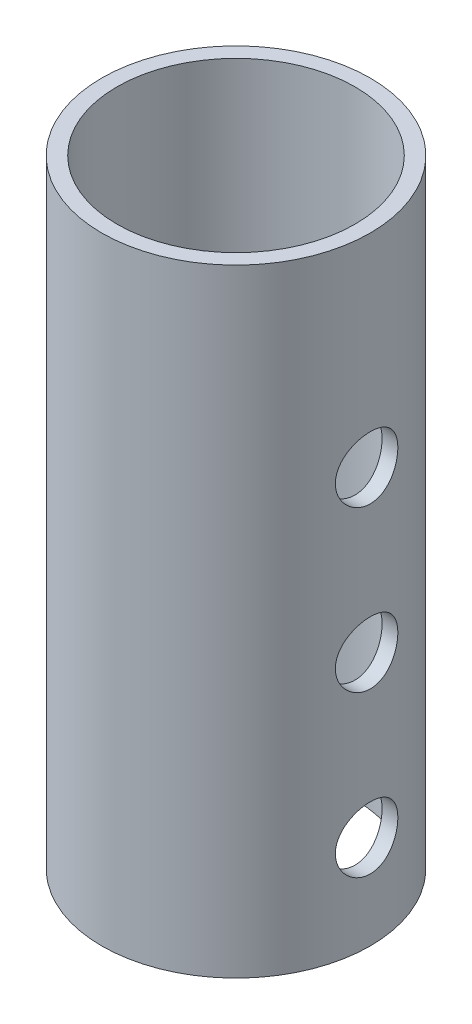
from build123d import *

# Parameters (mm, degrees)
SKETCH1_R           = 42.725
SKETCH1_R_2         = 37.875
BOSS_EXTRUDE1_DEPTH = 196.5
SKETCH2_R           = 9.94
CUT_EXTRUDE1_DEPTH  = 206.57991451
SKETCH4_R           = 7.5
CUT_EXTRUDE2_DEPTH  = 206.579914647


with BuildPart() as part:
    # Sketch1 → Boss-Extrude1 (new body)
    with BuildSketch(Plane(origin=(0, 0, 0), x_dir=(1, 0, 0), z_dir=(0, 1, 0))):
        Circle(SKETCH1_R)
        Circle(SKETCH1_R_2, mode=Mode.SUBTRACT)
    extrude(amount=BOSS_EXTRUDE1_DEPTH)

    # Sketch2 → Cut-Extrude1 (cut, through all)
    with BuildSketch(Plane(origin=(0, 0, 0), x_dir=(0, 0, -1), z_dir=(1, 0, 0))):
        with Locations((0, 131.8)):
            Circle(SKETCH2_R)
        with Locations((0, 80.8)):
            Circle(SKETCH2_R)
        with Locations((0, 29.8)):
            Circle(SKETCH2_R)
    extrude(amount=CUT_EXTRUDE1_DEPTH, mode=Mode.SUBTRACT)

    # Sketch4 → Cut-Extrude2 (cut, through all)
    with BuildSketch(Plane(origin=(0, 0, 0), x_dir=(0, 0, -1), z_dir=(1, 0, 0))):
        with Locations((0, 106.3)):
            Circle(SKETCH4_R)
    extrude(amount=-CUT_EXTRUDE2_DEPTH, mode=Mode.SUBTRACT)


solid = part.part
